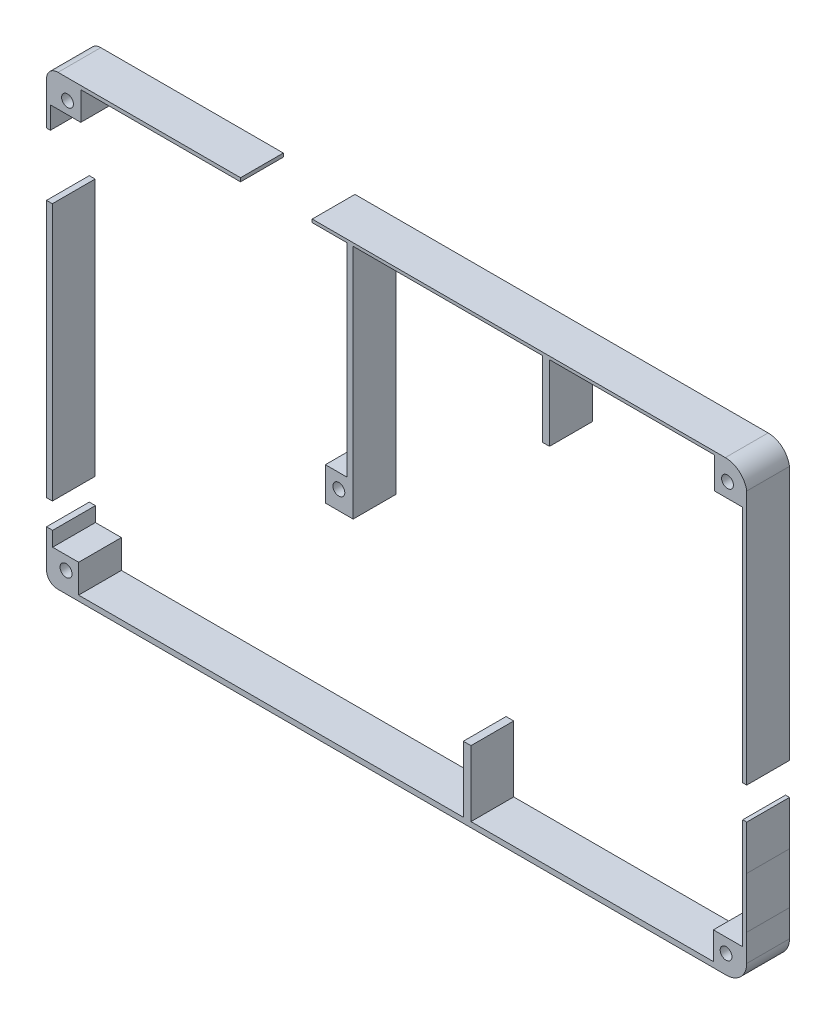
from build123d import *

# Parameters (mm, degrees)
SKETCH1_R             = 1.1
BOSS_EXTRUDE3_DEPTH   = 8
SKETCH1_W             = 1.094593603
SKETCH1_H             = 48.178198321
BOSS_EXTRUDE3_2_DEPTH = 8
SKETCH1_R_2           = 1.121026545
BOSS_EXTRUDE3_3_DEPTH = 8
SKETCH1_R_3           = 1.108702102
BOSS_EXTRUDE3_4_DEPTH = 8


with BuildPart() as part:
    # Sketch1 → Boss-Extrude3 (new body)
    with BuildSketch(Plane.XY):
        with BuildLine():
            Line((-71.139528935, 21.428422849), (-70.417889541, 21.428422849))
            Line((-70.417889541, 21.428422849), (-70.417889541, 25.560854365))
            Line((-70.417889541, 25.560854365), (-64.729927103, 25.560854365))
            Line((-64.729927103, 25.560854365), (-64.729927103, 30.868304852))
            Line((-64.729927103, 30.868304852), (-34.837528935, 30.868304852))
            Line((-34.837528935, 30.868304852), (-34.837528935, 31.542440849))
            Line((-34.837528935, 31.542440849), (-68.990518935, 31.542440849))
            ThreePointArc((-68.990518935, 31.542440849), (-70.508597211, 30.928859935), (-71.139528935, 29.417910449))
            Line((-71.139528935, 29.417910449), (-71.139528935, 21.428422849))
        make_face()
        with Locations((-67.212528935, 27.832422849)):
            Circle(SKETCH1_R, mode=Mode.SUBTRACT)
    extrude(amount=BOSS_EXTRUDE3_DEPTH)


with BuildPart() as body_2:
    # Sketch1 → Boss-Extrude3 2 (new body)
    with BuildSketch(Plane.XY):
        with Locations((-70.592232134, -14.363676311)):
            Rectangle(SKETCH1_W, SKETCH1_H)
    extrude(amount=BOSS_EXTRUDE3_2_DEPTH)


with BuildPart() as body_3:
    # Sketch1 → Boss-Extrude3 3 (new body)
    with BuildSketch(Plane.XY):
        with BuildLine():
            Line((-69.99028356, -43.160865916), (-71.139528935, -43.160865916))
            Line((-71.139528935, -43.160865916), (-71.139528935, -50.165167151))
            ThreePointArc((-71.139528935, -50.165167151), (-70.544574632, -51.613693989), (-69.103233935, -52.225852151))
            Line((-69.103233935, -52.225852151), (55.858471065, -52.225852151))
            ThreePointArc((55.858471065, -52.225852151), (58.668275294, -51.178208037), (59.848840565, -48.421611651))
            Line((59.848840565, -48.421611651), (59.848840565, -43.375865124))
            Line((59.848840565, -43.375865124), (59.858471065, -33.831805956))
            Line((59.858471065, -33.831805956), (59.858471065, -25.509940802))
            Line((59.858471065, -25.509940802), (59.110251744, -25.509940802))
            Line((59.110251744, -25.509940802), (59.110251744, -33.831805956))
            Line((59.110251744, -33.831805956), (59.110251744, -46.083615674))
            Line((59.110251744, -46.083615674), (58.750050727, -46.083615674))
            Line((58.750050727, -46.083615674), (53.62146451, -46.083615674))
            Line((53.62146451, -46.083615674), (53.62146451, -51.228867409))
            Line((53.62146451, -51.228867409), (8.267862422, -51.228867409))
            Line((8.267862422, -51.228867409), (8.267862422, -38.91890639))
            Line((8.267862422, -38.91890639), (6.836828924, -38.91890639))
            Line((6.836828924, -38.91890639), (6.836828924, -51.228867409))
            Line((6.836828924, -51.228867409), (-65.127137614, -51.228867409))
            Line((-65.127137614, -51.228867409), (-65.127137614, -45.902564706))
            Line((-65.127137614, -45.902564706), (-69.99028356, -45.902564706))
            Line((-69.99028356, -45.902564706), (-69.99028356, -43.160865916))
        make_face()
        with Locations((-67.489129998, -48.421611651)):
            Circle(SKETCH1_R_2, mode=Mode.SUBTRACT)
        with Locations((55.987471065, -48.717577151)):
            Circle(SKETCH1_R, mode=Mode.SUBTRACT)
    extrude(amount=BOSS_EXTRUDE3_3_DEPTH)


with BuildPart() as body_4:
    # Sketch1 → Boss-Extrude3 4 (new body)
    with BuildSketch(Plane.XY):
        with BuildLine():
            Line((59.046391745, -19.520082012), (59.858471065, -19.520082012))
            Line((59.858471065, -19.520082012), (59.858471065, -5.807577151))
            Line((59.858471065, -5.807577151), (59.858471065, 9.692422849))
            Line((59.858471065, 9.692422849), (59.858471065, 28.130213349))
            ThreePointArc((59.858471065, 28.130213349), (58.487829129, 30.574544207), (55.858471065, 31.544022849))
            Line((55.858471065, 31.544022849), (-21.437528935, 31.544022849))
            Line((-21.437528935, 31.544022849), (-21.437528935, 30.962598704))
            Line((-21.437528935, 30.962598704), (-14.90618833, 30.962598704))
            Line((-14.90618833, 30.962598704), (-14.90618833, -7.01699265))
            Line((-14.90618833, -7.01699265), (-18.970078841, -7.01699265))
            Line((-18.970078841, -7.01699265), (-18.970078841, -13.2402827))
            Line((-18.970078841, -13.2402827), (-13.775127918, -13.2402827))
            Line((-13.775127918, -13.2402827), (-13.775127918, -6.647744281))
            Line((-13.775127918, -6.647744281), (-13.775127918, -5.807577151))
            Line((-13.775127918, -5.807577151), (-13.775127918, 30.962598704))
            Line((-13.775127918, 30.962598704), (21.691612882, 30.962598704))
            Line((21.691612882, 30.962598704), (21.691612882, 16.913476409))
            Line((21.691612882, 16.913476409), (22.962873364, 16.913476409))
            Line((22.962873364, 16.913476409), (22.962873364, 30.962598704))
            Line((22.962873364, 30.962598704), (53.794517233, 30.962598704))
            Line((53.794517233, 30.962598704), (53.794517233, 25.121962728))
            Line((53.794517233, 25.121962728), (59.064141312, 25.121962728))
            Line((59.064141312, 25.121962728), (59.064141312, 1.081002472))
            Line((59.064141312, 1.081002472), (59.046391745, -5.807577151))
            Line((59.046391745, -5.807577151), (59.046391745, -19.520082012))
        make_face()
        with Locations((-16.447438663, -9.745441436)):
            Circle(SKETCH1_R_3, mode=Mode.SUBTRACT)
        with Locations((56.262471065, 27.832422849)):
            Circle(SKETCH1_R, mode=Mode.SUBTRACT)
    extrude(amount=BOSS_EXTRUDE3_4_DEPTH)


solid = Compound([part.part, body_2.part, body_3.part, body_4.part])
